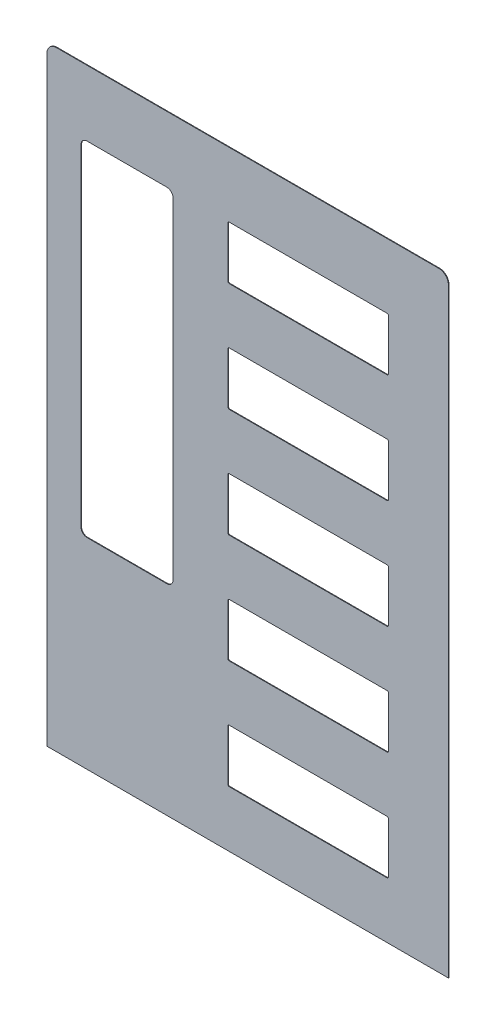
from build123d import *

# Parameters (mm, degrees)
BASE_FLANGE1_DEPTH = 1
CUT_EXTRUDE1_DEPTH = 10
CUT_EXTRUDE2_DEPTH = 10


# Sheet-metal steps are written as plain solids
with BuildPart() as part:
    # Sketch1 → Base-Flange1 (new body)
    with BuildSketch(Plane.XY):
        with BuildLine():
            Line((0, 0), (663.4, 0))
            Line((663.4, 0), (663.4, 992))
            ThreePointArc((663.4, 992), (658.801576465, 1003.101576465), (647.7, 1007.7))
            Line((647.7, 1007.7), (15.7, 1007.7))
            ThreePointArc((15.7, 1007.7), (4.598423535, 1003.101576465), (0, 992))
            Line((0, 992), (0, 0))
        make_face()
    extrude(amount=-BASE_FLANGE1_DEPTH)

    # Sketch9 → Cut-Extrude1 (cut)
    with BuildSketch(Plane.XY):
        with BuildLine():
            Line((562.2, 900.7), (301.2, 900.7))
            ThreePointArc((301.2, 900.7), (299.785786438, 900.114213562), (299.2, 898.7))
            Line((299.2, 898.7), (299.2, 814.7))
            ThreePointArc((299.2, 814.7), (299.785786438, 813.285786438), (301.2, 812.7))
            Line((301.2, 812.7), (562.2, 812.7))
            ThreePointArc((562.2, 812.7), (563.614213562, 813.285786438), (564.2, 814.7))
            Line((564.2, 814.7), (564.2, 898.7))
            ThreePointArc((564.2, 898.7), (563.614213562, 900.114213562), (562.2, 900.7))
        make_face()
        with BuildLine():
            Line((564.2, 718.7), (564.2, 634.7))
            ThreePointArc((564.2, 634.7), (563.614213562, 633.285786438), (562.2, 632.7))
            Line((562.2, 632.7), (301.2, 632.7))
            ThreePointArc((301.2, 632.7), (299.785786438, 633.285786438), (299.2, 634.7))
            Line((299.2, 634.7), (299.2, 718.7))
            ThreePointArc((299.2, 718.7), (299.785786438, 720.114213562), (301.2, 720.7))
            Line((301.2, 720.7), (562.2, 720.7))
            ThreePointArc((562.2, 720.7), (563.614213562, 720.114213562), (564.2, 718.7))
        make_face()
        with BuildLine():
            Line((564.2, 538.7), (564.2, 454.7))
            ThreePointArc((564.2, 454.7), (563.614213562, 453.285786438), (562.2, 452.7))
            Line((562.2, 452.7), (301.2, 452.7))
            ThreePointArc((301.2, 452.7), (299.785786438, 453.285786438), (299.2, 454.7))
            Line((299.2, 454.7), (299.2, 538.7))
            ThreePointArc((299.2, 538.7), (299.785786438, 540.114213562), (301.2, 540.7))
            Line((301.2, 540.7), (562.2, 540.7))
            ThreePointArc((562.2, 540.7), (563.614213562, 540.114213562), (564.2, 538.7))
        make_face()
        with BuildLine():
            Line((564.2, 358.7), (564.2, 274.7))
            ThreePointArc((564.2, 274.7), (563.614213562, 273.285786438), (562.2, 272.7))
            Line((562.2, 272.7), (301.2, 272.7))
            ThreePointArc((301.2, 272.7), (299.785786438, 273.285786438), (299.2, 274.7))
            Line((299.2, 274.7), (299.2, 358.7))
            ThreePointArc((299.2, 358.7), (299.785786438, 360.114213562), (301.2, 360.7))
            Line((301.2, 360.7), (562.2, 360.7))
            ThreePointArc((562.2, 360.7), (563.614213562, 360.114213562), (564.2, 358.7))
        make_face()
        with BuildLine():
            Line((564.2, 178.7), (564.2, 94.7))
            ThreePointArc((564.2, 94.7), (563.614213562, 93.285786438), (562.2, 92.7))
            Line((562.2, 92.7), (301.2, 92.7))
            ThreePointArc((301.2, 92.7), (299.785786438, 93.285786438), (299.2, 94.7))
            Line((299.2, 94.7), (299.2, 178.7))
            ThreePointArc((299.2, 178.7), (299.785786438, 180.114213562), (301.2, 180.7))
            Line((301.2, 180.7), (562.2, 180.7))
            ThreePointArc((562.2, 180.7), (563.614213562, 180.114213562), (564.2, 178.7))
        make_face()
    extrude(amount=-CUT_EXTRUDE1_DEPTH, mode=Mode.SUBTRACT)

    # Sketch10 → Cut-Extrude2 (cut)
    with BuildSketch(Plane.XY):
        with BuildLine():
            Line((66.2, 331.7), (198.2, 331.7))
            ThreePointArc((198.2, 331.7), (205.271067812, 334.628932188), (208.2, 341.7))
            Line((208.2, 341.7), (208.2, 889.2))
            ThreePointArc((208.2, 889.2), (205.271067812, 896.271067812), (198.2, 899.2))
            Line((198.2, 899.2), (66.2, 899.2))
            ThreePointArc((66.2, 899.2), (59.128932188, 896.271067812), (56.2, 889.2))
            Line((56.2, 889.2), (56.2, 341.7))
            ThreePointArc((56.2, 341.7), (59.128932188, 334.628932188), (66.2, 331.7))
        make_face()
    extrude(amount=-CUT_EXTRUDE2_DEPTH, mode=Mode.SUBTRACT)


solid = part.part
